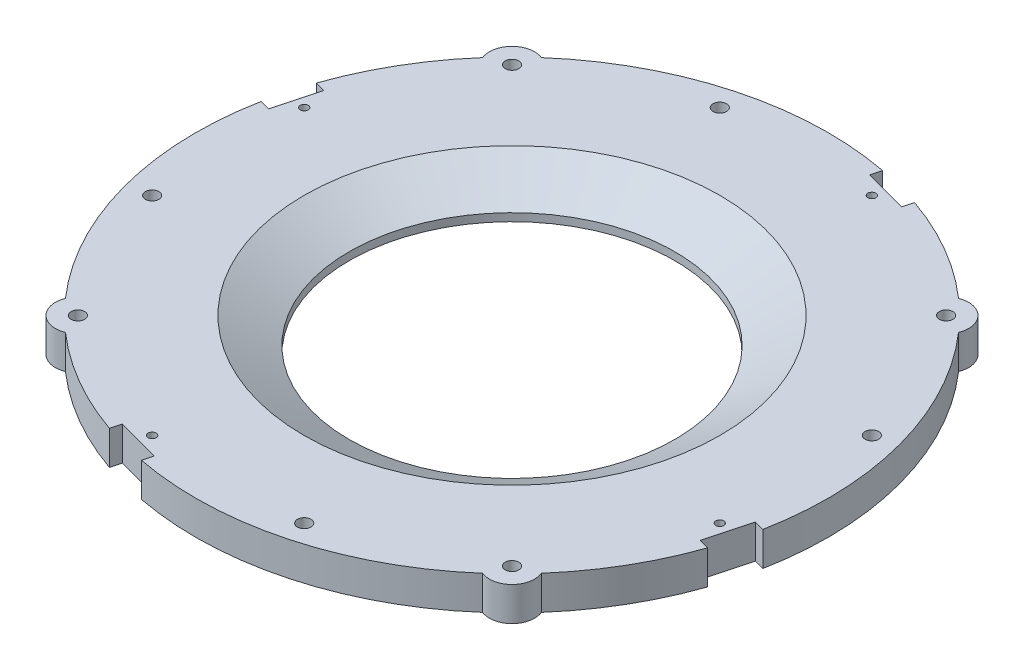
from build123d import *

# Parameters (mm, degrees)
SKETCH1_R           = 1.905
BOSS_EXTRUDE1_DEPTH = 9.525
SKETCH2_R           = 45.72
CUT_EXTRUDE1_DEPTH  = 12.7
SKETCH10_R          = 0.6985
CUT_EXTRUDE5_DEPTH  = 3.175
CIRPATTERN5_COUNT   = 4
CHAMFER1_SIZE       = 12.7
CHAMFER1_SIZE2      = 7.332348419
SKETCH4_R           = 1.905
CUT_EXTRUDE6_DEPTH  = 127.083883296
CIRPATTERN6_COUNT   = 4
SKETCH13_R          = 1.1303
CUT_EXTRUDE7_DEPTH  = 127.083883296
CIRPATTERN7_COUNT   = 4
SKETCH14_W          = 11.95230377
SKETCH14_H          = 12.7
CUT_EXTRUDE8_DEPTH  = 3.175
CIRPATTERN8_COUNT   = 4


with BuildPart() as part:
    # Sketch1 → Boss-Extrude1 (new body)
    with BuildSketch(Plane(origin=(0, 0, 0), x_dir=(1, 0, 0), z_dir=(0, 1, 0))):
        with BuildLine():
            ThreePointArc((-66.860826677, 58.590441679), (-88.9, 0), (-66.860826677, -58.590441679))
            ThreePointArc((-66.860826677, -58.590441679), (-65.466067123, -65.466067123), (-58.590441679, -66.860826677))
            ThreePointArc((-58.590441679, -66.860826677), (0, -88.9), (58.590441679, -66.860826677))
            ThreePointArc((58.590441679, -66.860826677), (65.466067123, -65.466067123), (66.860826677, -58.590441679))
            ThreePointArc((66.860826677, -58.590441679), (88.9, 0), (66.860826677, 58.590441679))
            ThreePointArc((66.860826677, 58.590441679), (65.466067123, 65.466067123), (58.590441679, 66.860826677))
            ThreePointArc((58.590441679, 66.860826677), (0, 88.9), (-58.590441679, 66.860826677))
            ThreePointArc((-58.590441679, 66.860826677), (-65.466067123, 65.466067123), (-66.860826677, 58.590441679))
        make_face()
        with Locations((-60.975939062, 60.975939062)):
            Circle(SKETCH1_R, mode=Mode.SUBTRACT)
        with Locations((60.975939062, 60.975939062)):
            Circle(SKETCH1_R, mode=Mode.SUBTRACT)
        with Locations((60.975939062, -60.975939062)):
            Circle(SKETCH1_R, mode=Mode.SUBTRACT)
        with Locations((-60.975939062, -60.975939062)):
            Circle(SKETCH1_R, mode=Mode.SUBTRACT)
    extrude(amount=BOSS_EXTRUDE1_DEPTH)

    # Sketch2 → Cut-Extrude1 (cut)
    with BuildSketch(Plane(origin=(0, 9.525, 0), x_dir=(1, 0, 0), z_dir=(0, 1, 0))):
        Circle(SKETCH2_R)
    extrude(amount=-CUT_EXTRUDE1_DEPTH, mode=Mode.SUBTRACT)

    # Sketch10 → Cut-Extrude5 (cut)
    with BuildSketch(Plane(origin=(-62.861792847, 0, -62.861792847), x_dir=(0, -1, 0), z_dir=(-0.7071067811865464, 0, -0.7071067811865488))):
        with Locations((-4.826, 0)):
            Circle(SKETCH10_R)
    cut_extrude5 = extrude(amount=-CUT_EXTRUDE5_DEPTH, mode=Mode.SUBTRACT)

    # CirPattern5: Cut-Extrude5 ×4 about axis
    cirpattern5_axis = Axis((0, 9.525, 0), (0, 1, 0))
    for i in range(1, CIRPATTERN5_COUNT):
        add(cut_extrude5.rotate(cirpattern5_axis, i * 360 / CIRPATTERN5_COUNT), mode=Mode.SUBTRACT)

    # Chamfer1
    chamfer1_edges = [part.edges().sort_by_distance(p)[0] for p in [
        (-45.72, 9.525, 0),
    ]]
    chamfer1_side = [part.faces().sort_by_distance(p)[0] for p in [
        (0, 9.525, -86.385528286),
    ]]
    chamfer(chamfer1_edges, length=CHAMFER1_SIZE, length2=CHAMFER1_SIZE2, reference=chamfer1_side[0])

    # Sketch4 → Cut-Extrude6 (cut, through all)
    with BuildSketch(Plane(origin=(0, 9.525, 0), x_dir=(1, 0, 0), z_dir=(0, 1, 0))):
        with Locations((-21.365512173, 79.73717696)):
            Circle(SKETCH4_R)
    cut_extrude6 = extrude(amount=-CUT_EXTRUDE6_DEPTH, mode=Mode.SUBTRACT)

    # CirPattern6: Cut-Extrude6 ×4 about axis
    cirpattern6_axis = Axis((0, 9.525, 0), (0, 1, 0))
    for i in range(1, CIRPATTERN6_COUNT):
        add(cut_extrude6.rotate(cirpattern6_axis, i * 360 / CIRPATTERN6_COUNT), mode=Mode.SUBTRACT)

    # Sketch13 → Cut-Extrude7 (cut, through all)
    with BuildSketch(Plane(origin=(0, 9.525, 0), x_dir=(1, 0, 0), z_dir=(0, 1, 0))):
        with Locations((21.365512173, 79.73717696)):
            Circle(SKETCH13_R)
    cut_extrude7 = extrude(amount=-CUT_EXTRUDE7_DEPTH, mode=Mode.SUBTRACT)

    # CirPattern7: Cut-Extrude7 ×4 about axis
    cirpattern7_axis = Axis((0, 9.525, 0), (0, 1, 0))
    for i in range(1, CIRPATTERN7_COUNT):
        add(cut_extrude7.rotate(cirpattern7_axis, i * 360 / CIRPATTERN7_COUNT), mode=Mode.SUBTRACT)

    # Sketch14 → Cut-Extrude8 (cut)
    with BuildSketch(Plane(origin=(23.00901311, 0, -85.870805957), x_dir=(0, -1, 0), z_dir=(0.25881904510252474, 0, -0.9659258262890673))):
        with Locations((-4.621692603, 0)):
            Rectangle(SKETCH14_W, SKETCH14_H)
    cut_extrude8 = extrude(amount=-CUT_EXTRUDE8_DEPTH, mode=Mode.SUBTRACT)

    # CirPattern8: Cut-Extrude8 ×4 about axis
    cirpattern8_axis = Axis((0, 9.525, 0), (0, 1, 0))
    for i in range(1, CIRPATTERN8_COUNT):
        add(cut_extrude8.rotate(cirpattern8_axis, i * 360 / CIRPATTERN8_COUNT), mode=Mode.SUBTRACT)


solid = part.part
